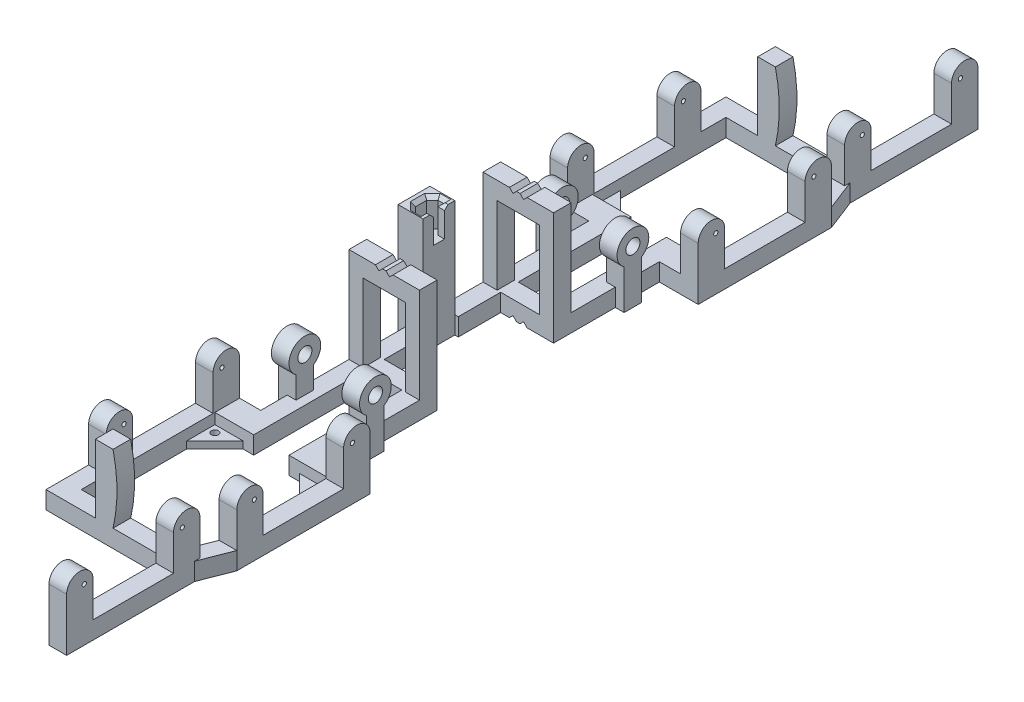
from build123d import *

# Parameters (mm, degrees)
SKETCH_2_5_W               = 5
SKETCH_2_5_H               = 5
RAIL1_DEPTH                = 27.5
ARCHFORTHREAD1_DEPTH       = 2.5
RAIL2_DEPTH                = 2.5
SKETCH_3_W                 = 5
SKETCH_3_H                 = 5
CELLNEST_DEPTH             = 14.5
SKETCH_4_W                 = 7.05
SKETCH_4_H                 = 9
EXTRUDE_6_DEPTH            = 25
EXTRUDE_7_DEPTH            = 8
CHAMFER_1_SIZE             = 1
SKETCH_7_R                 = 2
EXTRUDE_8_DEPTH            = 2.5
SKETCH_12_W                = 16
SKETCH_12_H                = 7
EXTRUDE_9_DEPTH            = 5
SKETCH_13_R                = 0.6
EXTRUDE_10_DEPTH           = 5
EXTRUDE_11_DEPTH           = 5
PATTERN_LINEAR_1_COUNT     = 2
PATTERN_LINEAR_1_PITCH     = 45
EXTRUDE_12_DEPTH           = 5
EXTRUDE_13_DEPTH           = 5
MIRROR_13_COPY_1_DEPTH     = 2.5
MIRROR_13_COPY_2_DEPTH     = 2.5
MIRROR_21_COPY_1_SKETCH_W  = 5
MIRROR_21_COPY_1_SKETCH_H  = 5
MIRROR_21_COPY_1_DEPTH     = 27.5
MIRROR_21_COPY_2_SKETCH_W  = 5
MIRROR_21_COPY_2_SKETCH_H  = 5
MIRROR_21_COPY_2_DEPTH     = 27.5
MIRROR_21_COPY_3_DEPTH     = 2.5
MIRROR_21_COPY_4_DEPTH     = 2.5
MIRROR_22_COPY_1_SKETCH_R  = 2
MIRROR_22_COPY_1_DEPTH     = 2.5
MIRROR_22_COPY_2_SKETCH_R  = 2
MIRROR_22_COPY_2_DEPTH     = 2.5
MIRROR_23_COPY_1_SKETCH_W  = 16
MIRROR_23_COPY_1_SKETCH_H  = 7
MIRROR_23_COPY_1_DEPTH     = 5
MIRROR_23_COPY_2_SKETCH_R  = 0.6
MIRROR_23_COPY_2_DEPTH     = 5
MIRROR_23_COPY_3_SKETCH_W  = 16
MIRROR_23_COPY_3_SKETCH_H  = 7
MIRROR_23_COPY_3_DEPTH     = 5
MIRROR_23_COPY_4_SKETCH_R  = 0.6
MIRROR_23_COPY_4_DEPTH     = 5
MIRROR_25_COPY_1_SKETCH_R  = 0.6
MIRROR_25_COPY_1_DEPTH     = 5
MIRROR_25_COPY_2_SKETCH_R  = 0.6
MIRROR_25_COPY_2_DEPTH     = 5
SKETCH_18_R                = 1
EXTRUDE_14_DEPTH           = 2
MIRROR_2_2_COPY_1_SKETCH_R = 1
MIRROR_2_2_COPY_1_DEPTH    = 2
MIRROR_2_2_COPY_2_SKETCH_R = 1
MIRROR_2_2_COPY_2_DEPTH    = 2


with BuildPart() as part:
    # Эскиз2<5> → Rail1 (new body)
    with BuildSketch(Plane.XY):
        with Locations((7.5, 2.5)):
            Rectangle(SKETCH_2_5_W, SKETCH_2_5_H)
    rail1 = extrude(amount=-RAIL1_DEPTH)

    # Эскиз2 → ArchForThread1 (add, symmetric)
    with BuildSketch(Plane.XY):
        Polygon((0, 5), (0, 0), (0.5, 0), (1.5, 1), (2.5, 0), (5, 0), (5, 5), align=None)
        Polygon((6, 27), (6, 5), (10, 5), (10, 32), (2.5, 32), (1.5, 31), (0.5, 32), (0, 32), (0, 27), align=None)
    archforthread1 = extrude(amount=ARCHFORTHREAD1_DEPTH, both=True)

    # Mirror 2: ArchForThread1 across plane
    add(archforthread1.mirror(Plane(origin=(0, 0, 0), x_dir=(0, 0, 1), z_dir=(1, 0, 0))))

    # Зеркальное отражение3: Rail1 across plane
    add(rail1.mirror(Plane(origin=(0, 0, 0), x_dir=(0, 0, 1), z_dir=(1, 0, 0))))

    # Эскиз2<6> → Rail2 (add)
    with BuildSketch(Plane.XY):
        Polygon((6, 5), (5, 5), (5, 0), (10, 0), (10, 5), align=None)
    rail2 = extrude(amount=RAIL2_DEPTH)

    # Эскиз3 → CellNest (add)
    with BuildSketch(Plane.XY):
        with Locations((-7.5, 2.5)):
            Rectangle(SKETCH_3_W, SKETCH_3_H)
    cellnest = extrude(amount=CELLNEST_DEPTH)

    # Эскиз4 → Бобышка-Вытянуть6 (add)
    with BuildSketch(Plane(origin=(0, 0, 0), x_dir=(1, 0, 0), z_dir=(0, 1, 0))):
        with Locations((-9.525, -19)):
            Rectangle(SKETCH_4_W, SKETCH_4_H)
    extrude(amount=EXTRUDE_6_DEPTH)

    # Эскиз5 → Бобышка-Вытянуть7 (add)
    with BuildSketch(Plane(origin=(0, 25, 0), x_dir=(1, 0, 0), z_dir=(0, 1, 0))):
        Polygon((-13.05, -23.5), (-6, -23.5), (-6, -20.6), (-7.85, -20.6), (-7.85, -22.2), (-9.45, -22.2), (-11.05, -20.6), (-11.05, -17.4), (-9.45, -15.8), (-7.85, -15.8), (-7.85, -17.4), (-6, -17.4), (-6, -14.5), (-13.05, -14.5), align=None)
    extrude(amount=EXTRUDE_7_DEPTH)

    # Фаска1
    chamfer_1_edges = [part.edges().sort_by_distance(p)[0] for p in [
        (-6.925, 33, 20.6),
        (-7.85, 33, 21.4),
        (-8.65, 33, 22.2),
        (-10.25, 33, 21.4),
        (-6.925, 33, 17.4),
        (-7.85, 33, 16.6),
        (-8.65, 33, 15.8),
        (-10.25, 33, 16.6),
        (-11.05, 33, 19),
    ]]
    chamfer(chamfer_1_edges, length=CHAMFER_1_SIZE)

    # Эскиз7 → Бобышка-Вытянуть8 (add, symmetric)
    with BuildSketch(Plane(origin=(10, 0, 0), x_dir=(0, 0, -1), z_dir=(1, 0, 0))):
        with BuildLine():
            Line((20, 11.258342613), (20, 0))
            Line((20, 0), (15, 0))
            Line((15, 0), (15, 11.258342613))
            ThreePointArc((15, 11.258342613), (17.5, 19.5), (20, 11.258342613))
        make_face()
        with Locations((17.5, 15)):
            Circle(SKETCH_7_R, mode=Mode.SUBTRACT)
    extrude_8 = extrude(amount=EXTRUDE_8_DEPTH, both=True)

    # Зеркальное отражение4: Бобышка-Вытянуть8 across plane
    add(extrude_8.mirror(Plane(origin=(0, 0, 0), x_dir=(0, 0, 1), z_dir=(1, 0, 0))))

    # Эскиз12 → Бобышка-Вытянуть9 (add)
    with BuildSketch(Plane(origin=(0, 0, 0), x_dir=(1, 0, 0), z_dir=(0, 1, 0))):
        with Locations((13, 31)):
            Rectangle(SKETCH_12_W, SKETCH_12_H)
    extrude_9 = extrude(amount=EXTRUDE_9_DEPTH)

    # Эскиз13 → Бобышка-Вытянуть10 (add)
    with BuildSketch(Plane(origin=(21, 0, 0), x_dir=(0, 0, -1), z_dir=(1, 0, 0))):
        with BuildLine():
            Line((27.5, 0), (65.3, 0))
            Line((65.3, 0), (65.3, 15))
            ThreePointArc((65.3, 15), (61.55, 18.75), (57.8, 15))
            Line((57.8, 15), (57.8, 5))
            Line((57.8, 5), (35, 5))
            Line((35, 5), (35, 15))
            ThreePointArc((35, 15), (31.25, 18.75), (27.5, 15))
            Line((27.5, 15), (27.5, 0))
        make_face()
        with Locations((32.5, 15)):
            Circle(SKETCH_13_R, mode=Mode.SUBTRACT)
        with Locations((60.3, 15)):
            Circle(SKETCH_13_R, mode=Mode.SUBTRACT)
    extrude_10 = extrude(amount=-EXTRUDE_10_DEPTH)

    # Зеркальное отражение5: Бобышка-Вытянуть9, Бобышка-Вытянуть10 across plane
    add(extrude_9.mirror(Plane(origin=(0, 0, 0), x_dir=(0, 0, 1), z_dir=(1, 0, 0))))
    add(extrude_10.mirror(Plane(origin=(0, 0, 0), x_dir=(0, 0, 1), z_dir=(1, 0, 0))))

    # Эскиз14 → Бобышка-Вытянуть11 (add)
    with BuildSketch(Plane(origin=(0, 0, 0), x_dir=(1, 0, 0), z_dir=(0, 1, 0))):
        Polygon((21, 65.3), (17.5, 74.3), (12.5, 74.3), (16, 65.3), align=None)
    extrude_11 = extrude(amount=EXTRUDE_11_DEPTH)

    # Линейный массив1: Бобышка-Вытянуть10 ×2
    with Locations(*[Vector(-0.07457805825848672, 0, -0.9972151789991937) * (i * PATTERN_LINEAR_1_PITCH) for i in range(1, PATTERN_LINEAR_1_COUNT)]):
        add(extrude_10)

    # Эскиз15 → Бобышка-Вытянуть12 (add)
    with BuildSketch(Plane(origin=(0, 0, 0), x_dir=(1, 0, 0), z_dir=(0, 1, 0))):
        Polygon((13.248734368, 72.374683055), (-16, 72.374683055), (-16, 65.3), (-21.000237038, 65.3), (-21.000237038, 72.374683055), (-21.000237038, 77.374683055), (13.248734368, 77.374683055), align=None)
    extrude_12 = extrude(amount=EXTRUDE_12_DEPTH)

    # Эскиз16 → Бобышка-Вытянуть13 (add)
    with BuildSketch(Plane(origin=(0, 0, -77.374683055), x_dir=(-1, 0, 0), z_dir=(0, 0, -1))):
        with BuildLine():
            Line((7.000237038, 24.370480215), (2.000237038, 24.370480215))
            ThreePointArc((2.000237038, 24.370480215), (0.881288878, 14.685240107), (2.000237038, 5))
            Line((2.000237038, 5), (7.000237038, 5))
            Line((7.000237038, 5), (7.000237038, 24.370480215))
        make_face()
    extrude_13 = extrude(amount=-EXTRUDE_13_DEPTH)

    # Зеркальное отражение8: CellNest across plane
    add(cellnest.mirror(Plane.XY.offset(19)))

    # Зеркальное отражение13 copy 1 sketch → Зеркальное отражение13 copy 1 (add, symmetric)
    with BuildSketch(Plane(origin=(0, 0, 38), x_dir=(-1, 0, 0), z_dir=(0, 0, -1))):
        Polygon((0, 5), (0, 0), (0.5, 0), (1.5, 1), (2.5, 0), (5, 0), (5, 5), align=None)
        Polygon((6, 27), (6, 5), (10, 5), (10, 32), (2.5, 32), (1.5, 31), (0.5, 32), (0, 32), (0, 27), align=None)
    extrude(amount=MIRROR_13_COPY_1_DEPTH, both=True)

    # Зеркальное отражение13 copy 2 sketch → Зеркальное отражение13 copy 2 (add, symmetric)
    with BuildSketch(Plane(origin=(0, 0, 38), x_dir=(1, 0, 0), z_dir=(0, 0, -1))):
        Polygon((0, -5), (0, 0), (0.5, 0), (1.5, -1), (2.5, 0), (5, 0), (5, -5), align=None)
        Polygon((6, -27), (6, -5), (10, -5), (10, -32), (2.5, -32), (1.5, -31), (0.5, -32), (0, -32), (0, -27), align=None)
    extrude(amount=MIRROR_13_COPY_2_DEPTH, both=True)

    # Зеркальное отражение19: Rail1 across plane
    add(rail1.mirror(Plane.XY.offset(19)))

    # Зеркальное отражение20: Rail2 across plane
    add(rail2.mirror(Plane.XY.offset(19)))

    # Зеркальное отражение21 copy 1 sketch → Зеркальное отражение21 copy 1 (add)
    with BuildSketch(Plane(origin=(0, 0, 38), x_dir=(-1, 0, 0), z_dir=(0, 0, -1))):
        with Locations((7.5, 2.5)):
            Rectangle(MIRROR_21_COPY_1_SKETCH_W, MIRROR_21_COPY_1_SKETCH_H)
    extrude(amount=-MIRROR_21_COPY_1_DEPTH)

    # Зеркальное отражение21 copy 2 sketch → Зеркальное отражение21 copy 2 (add)
    with BuildSketch(Plane(origin=(0, 0, 0), x_dir=(-1, 0, 0), z_dir=(0, 0, 1))):
        with Locations((7.5, -2.5)):
            Rectangle(MIRROR_21_COPY_2_SKETCH_W, MIRROR_21_COPY_2_SKETCH_H)
    extrude(amount=-MIRROR_21_COPY_2_DEPTH)

    # Зеркальное отражение21 copy 3 sketch → Зеркальное отражение21 copy 3 (add)
    with BuildSketch(Plane(origin=(0, 0, 38), x_dir=(-1, 0, 0), z_dir=(0, 0, -1))):
        Polygon((6, 5), (5, 5), (5, 0), (10, 0), (10, 5), align=None)
    extrude(amount=MIRROR_21_COPY_3_DEPTH)

    # Зеркальное отражение21 copy 4 sketch → Зеркальное отражение21 copy 4 (add)
    with BuildSketch(Plane(origin=(0, 0, 0), x_dir=(-1, 0, 0), z_dir=(0, 0, 1))):
        Polygon((6, -5), (5, -5), (5, 0), (10, 0), (10, -5), align=None)
    extrude(amount=MIRROR_21_COPY_4_DEPTH)

    # Зеркальное отражение22 copy 1 sketch → Зеркальное отражение22 copy 1 (add, symmetric)
    with BuildSketch(Plane(origin=(-10, 0, 38), x_dir=(0, 0, 1), z_dir=(-1, 0, 0))):
        with BuildLine():
            Line((20, 11.258342613), (20, 0))
            Line((20, 0), (15, 0))
            Line((15, 0), (15, 11.258342613))
            ThreePointArc((15, 11.258342613), (17.5, 19.5), (20, 11.258342613))
        make_face()
        with Locations((17.5, 15)):
            Circle(MIRROR_22_COPY_1_SKETCH_R, mode=Mode.SUBTRACT)
    extrude(amount=MIRROR_22_COPY_1_DEPTH, both=True)

    # Зеркальное отражение22 copy 2 sketch → Зеркальное отражение22 copy 2 (add, symmetric)
    with BuildSketch(Plane(origin=(10, 0, 38), x_dir=(0, 0, 1), z_dir=(1, 0, 0))):
        with BuildLine():
            Line((20, -11.258342613), (20, 0))
            Line((20, 0), (15, 0))
            Line((15, 0), (15, -11.258342613))
            ThreePointArc((15, -11.258342613), (17.5, -19.5), (20, -11.258342613))
        make_face()
        with Locations((17.5, -15)):
            Circle(MIRROR_22_COPY_2_SKETCH_R, mode=Mode.SUBTRACT)
    extrude(amount=MIRROR_22_COPY_2_DEPTH, both=True)

    # Зеркальное отражение23 copy 1 sketch → Зеркальное отражение23 copy 1 (add)
    with BuildSketch(Plane(origin=(0, 0, 38), x_dir=(-1, 0, 0), z_dir=(0, 1, 0))):
        with Locations((13, 31)):
            Rectangle(MIRROR_23_COPY_1_SKETCH_W, MIRROR_23_COPY_1_SKETCH_H)
    extrude(amount=MIRROR_23_COPY_1_DEPTH)

    # Зеркальное отражение23 copy 2 sketch → Зеркальное отражение23 copy 2 (add)
    with BuildSketch(Plane(origin=(-21, 0, 38), x_dir=(0, 0, 1), z_dir=(-1, 0, 0))):
        with BuildLine():
            Line((27.5, 0), (65.3, 0))
            Line((65.3, 0), (65.3, 15))
            ThreePointArc((65.3, 15), (61.55, 18.75), (57.8, 15))
            Line((57.8, 15), (57.8, 5))
            Line((57.8, 5), (35, 5))
            Line((35, 5), (35, 15))
            ThreePointArc((35, 15), (31.25, 18.75), (27.5, 15))
            Line((27.5, 15), (27.5, 0))
        make_face()
        with Locations((32.5, 15)):
            Circle(MIRROR_23_COPY_2_SKETCH_R, mode=Mode.SUBTRACT)
        with Locations((60.3, 15)):
            Circle(MIRROR_23_COPY_2_SKETCH_R, mode=Mode.SUBTRACT)
    extrude(amount=-MIRROR_23_COPY_2_DEPTH)

    # Зеркальное отражение23 copy 3 sketch → Зеркальное отражение23 copy 3 (add)
    with BuildSketch(Plane(origin=(0, 0, 38), x_dir=(1, 0, 0), z_dir=(0, 1, 0))):
        with Locations((13, -31)):
            Rectangle(MIRROR_23_COPY_3_SKETCH_W, MIRROR_23_COPY_3_SKETCH_H)
    extrude(amount=MIRROR_23_COPY_3_DEPTH)

    # Зеркальное отражение23 copy 4 sketch → Зеркальное отражение23 copy 4 (add)
    with BuildSketch(Plane(origin=(21, 0, 38), x_dir=(0, 0, 1), z_dir=(1, 0, 0))):
        with BuildLine():
            Line((27.5, 0), (65.3, 0))
            Line((65.3, 0), (65.3, -15))
            ThreePointArc((65.3, -15), (61.55, -18.75), (57.8, -15))
            Line((57.8, -15), (57.8, -5))
            Line((57.8, -5), (35, -5))
            Line((35, -5), (35, -15))
            ThreePointArc((35, -15), (31.25, -18.75), (27.5, -15))
            Line((27.5, -15), (27.5, 0))
        make_face()
        with Locations((32.5, -15)):
            Circle(MIRROR_23_COPY_4_SKETCH_R, mode=Mode.SUBTRACT)
        with Locations((60.3, -15)):
            Circle(MIRROR_23_COPY_4_SKETCH_R, mode=Mode.SUBTRACT)
    extrude(amount=-MIRROR_23_COPY_4_DEPTH)

    # Зеркальное отражение24: Бобышка-Вытянуть11 across plane
    add(extrude_11.mirror(Plane.XY.offset(19)))

    # Зеркальное отражение25 copy 1 sketch → Зеркальное отражение25 copy 1 (add)
    with BuildSketch(Plane(origin=(17.643987378, 0, 82.874683055), x_dir=(0, 0, 1), z_dir=(1, 0, 0))):
        with BuildLine():
            Line((27.5, 0), (65.3, 0))
            Line((65.3, 0), (65.3, -15))
            ThreePointArc((65.3, -15), (61.55, -18.75), (57.8, -15))
            Line((57.8, -15), (57.8, -5))
            Line((57.8, -5), (35, -5))
            Line((35, -5), (35, -15))
            ThreePointArc((35, -15), (31.25, -18.75), (27.5, -15))
            Line((27.5, -15), (27.5, 0))
        make_face()
        with Locations((32.5, -15)):
            Circle(MIRROR_25_COPY_1_SKETCH_R, mode=Mode.SUBTRACT)
        with Locations((60.3, -15)):
            Circle(MIRROR_25_COPY_1_SKETCH_R, mode=Mode.SUBTRACT)
    extrude(amount=-MIRROR_25_COPY_1_DEPTH)

    # Зеркальное отражение25 copy 2 sketch → Зеркальное отражение25 copy 2 (add)
    with BuildSketch(Plane(origin=(21, 0, 38), x_dir=(0, 0, 1), z_dir=(1, 0, 0))):
        with BuildLine():
            Line((27.5, 0), (65.3, 0))
            Line((65.3, 0), (65.3, -15))
            ThreePointArc((65.3, -15), (61.55, -18.75), (57.8, -15))
            Line((57.8, -15), (57.8, -5))
            Line((57.8, -5), (35, -5))
            Line((35, -5), (35, -15))
            ThreePointArc((35, -15), (31.25, -18.75), (27.5, -15))
            Line((27.5, -15), (27.5, 0))
        make_face()
        with Locations((32.5, -15)):
            Circle(MIRROR_25_COPY_2_SKETCH_R, mode=Mode.SUBTRACT)
        with Locations((60.3, -15)):
            Circle(MIRROR_25_COPY_2_SKETCH_R, mode=Mode.SUBTRACT)
    extrude(amount=-MIRROR_25_COPY_2_DEPTH)

    # Зеркальное отражение26: Бобышка-Вытянуть12, Бобышка-Вытянуть13 across plane
    add(extrude_12.mirror(Plane.XY.offset(19)))
    add(extrude_13.mirror(Plane.XY.offset(19)))

    # Эскиз18 → Бобышка-Вытянуть14 (add)
    with BuildSketch(Plane(origin=(0, 0, 0), x_dir=(1, 0, 0), z_dir=(0, 1, 0))):
        Polygon((16, 34.5), (8, 34.5), (16, 42.5), align=None)
        with Locations((14, 36.5)):
            Circle(SKETCH_18_R, mode=Mode.SUBTRACT)
    extrude_14 = extrude(amount=EXTRUDE_14_DEPTH)

    # Mirror 5159: Бобышка-Вытянуть14 across plane
    add(extrude_14.mirror(Plane(origin=(0, 0, 0), x_dir=(0, 0, 1), z_dir=(1, 0, 0))))

    # Mirror 2 2 copy 1 sketch → Mirror 2 2 copy 1 (add)
    with BuildSketch(Plane(origin=(0, 0, 38), x_dir=(-1, 0, 0), z_dir=(0, 1, 0))):
        Polygon((16, 34.5), (8, 34.5), (16, 42.5), align=None)
        with Locations((14, 36.5)):
            Circle(MIRROR_2_2_COPY_1_SKETCH_R, mode=Mode.SUBTRACT)
    extrude(amount=MIRROR_2_2_COPY_1_DEPTH)

    # Mirror 2 2 copy 2 sketch → Mirror 2 2 copy 2 (add)
    with BuildSketch(Plane(origin=(0, 0, 38), x_dir=(1, 0, 0), z_dir=(0, 1, 0))):
        Polygon((16, -34.5), (8, -34.5), (16, -42.5), align=None)
        with Locations((14, -36.5)):
            Circle(MIRROR_2_2_COPY_2_SKETCH_R, mode=Mode.SUBTRACT)
    extrude(amount=MIRROR_2_2_COPY_2_DEPTH)


solid = part.part
